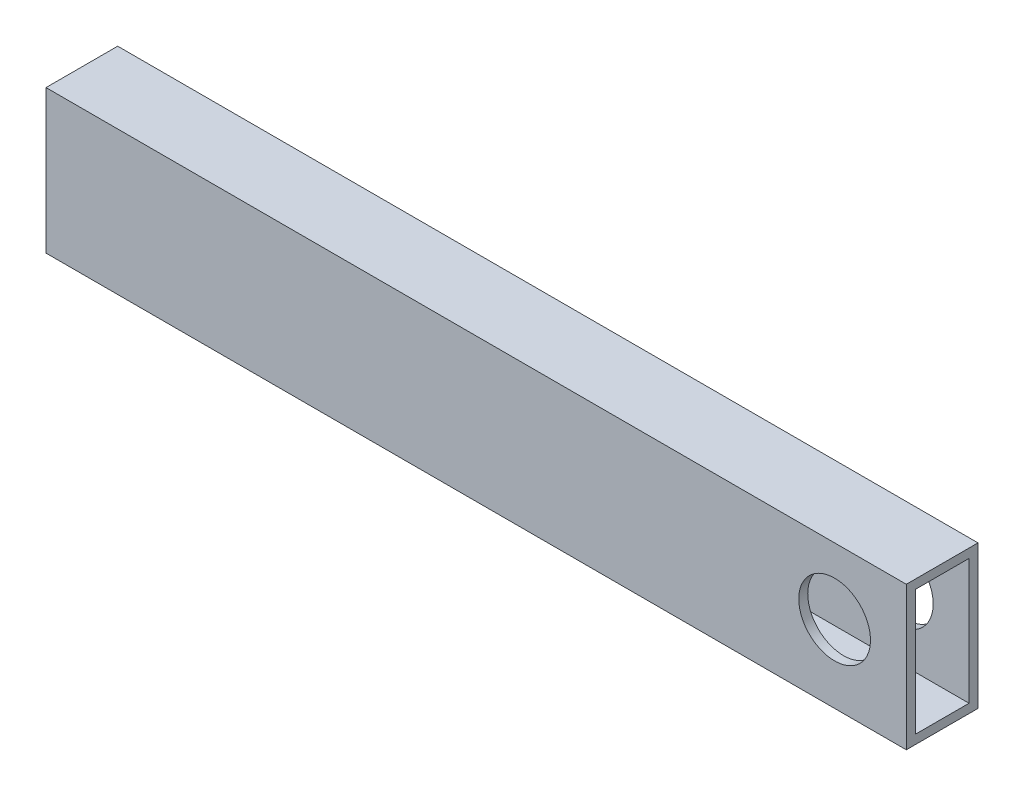
from build123d import *

# Parameters (mm, degrees)
SKETCH1_W               = 25.4
SKETCH1_H               = 50.8
SKETCH1_W_2             = 19.05
SKETCH1_H_2             = 44.45
BOSS_EXTRUDE1_DEPTH     = 304.8
CUT_EXTRUDE1_DEPTH      = 311.04651264
CUT_EXTRUDE1_DEPTH_BACK = 311.04651264
SKETCH2_R               = 12.7


with BuildPart() as part:
    # Sketch1 → Boss-Extrude1 (new body)
    with BuildSketch(Plane(origin=(0, 0, 0), x_dir=(0, 0, -1), z_dir=(1, 0, 0))):
        with Locations((12.7, 25.4)):
            Rectangle(SKETCH1_W, SKETCH1_H)
        with Locations((12.7, 25.4)):
            Rectangle(SKETCH1_W_2, SKETCH1_H_2, mode=Mode.SUBTRACT)
    extrude(amount=BOSS_EXTRUDE1_DEPTH)

    # Sketch2 → Cut-Extrude1 (cut, two sides: drawn at the far end of the back side and taken through both)
    with BuildSketch(Plane(origin=(0, 0, -25.4), x_dir=(-1, 0, 0), z_dir=(0, 0, -1)).offset(-CUT_EXTRUDE1_DEPTH_BACK)):
        with Locations((-279.4, 27.283270028)):
            Circle(SKETCH2_R)
    extrude(amount=CUT_EXTRUDE1_DEPTH + CUT_EXTRUDE1_DEPTH_BACK, mode=Mode.SUBTRACT)


solid = part.part
